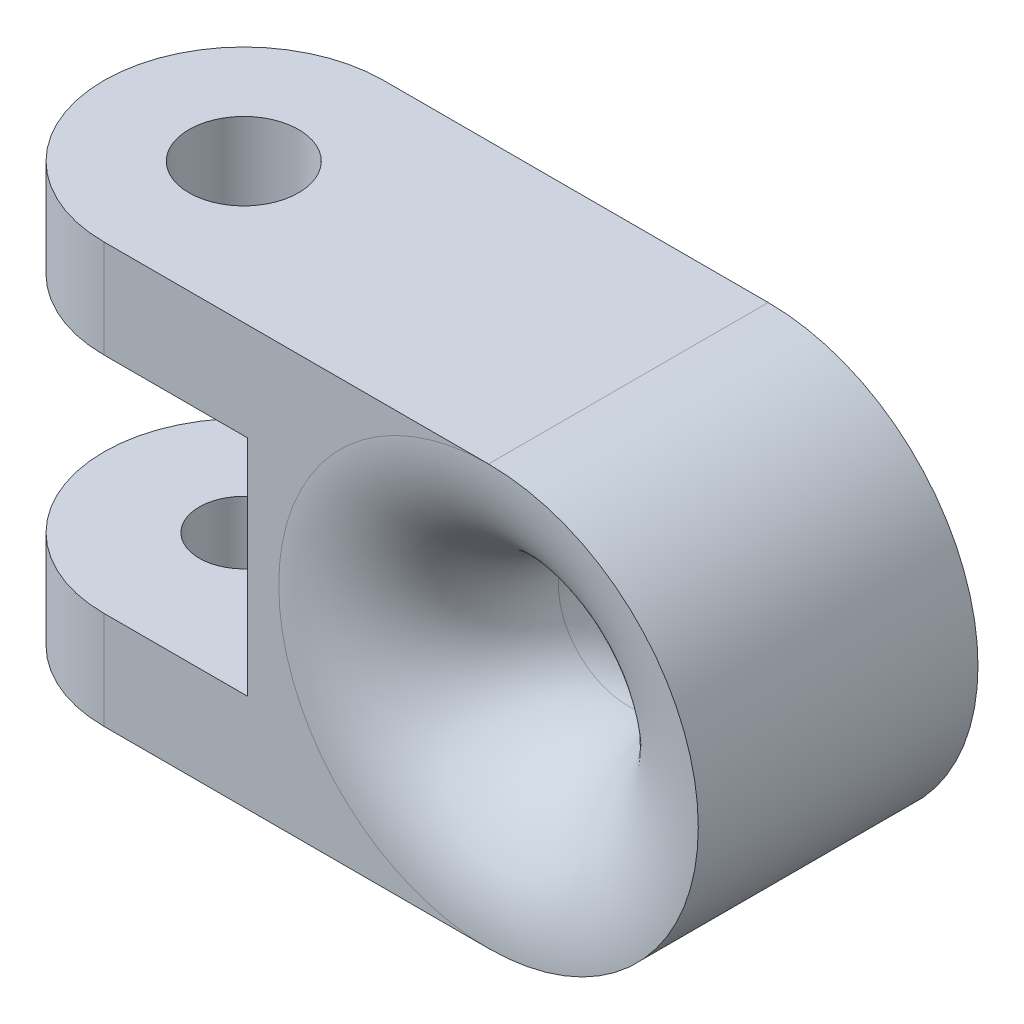
from build123d import *

# Parameters (mm, degrees)
BOSS_EXTRUDE1_DEPTH         = 9.525
BOSS_EXTRUDE2_DEPTH         = 12.7
CUT_EXTRUDE1_DEPTH          = 5.08
F_10_32_TAPPED_HOLE1_D      = 4.0386
F_10_32_TAPPED_HOLE1_DEPTH  = 4.445
F_10_CLEARANCE_HOLE1_D      = 4.9784
F_10_CLEARANCE_HOLE1_DEPTH  = 14.604
F_1_4_0_25_DIAMETER_HOLE1_D = 6.35
FILLET1_R                   = 6.35


with BuildPart() as part:
    # Sketch1 → Boss-Extrude1 (new, symmetric)
    with BuildSketch(Plane(origin=(0, 0, 0), x_dir=(1, 0, 0), z_dir=(0, 1, 0))):
        with BuildLine():
            Line((0, -6.35), (-11.1125, -6.35))
            ThreePointArc((-11.1125, -6.35), (-17.4625, 0), (-11.1125, 6.35))
            Line((-11.1125, 6.35), (0, 6.35))
            Line((0, 6.35), (0, -6.35))
        make_face()
    extrude(amount=BOSS_EXTRUDE1_DEPTH, both=True)

    # Sketch2 → Boss-Extrude2 (add)
    with BuildSketch(Plane.XY.offset(6.35)):
        with BuildLine():
            Line((0, 9.525), (6.35, 9.525))
            ThreePointArc((6.35, 9.525), (15.875, 0), (6.35, -9.525))
            Line((6.35, -9.525), (0, -9.525))
            ThreePointArc((0, -9.525), (-9.525, 0), (0, 9.525))
        make_face()
    extrude(amount=-BOSS_EXTRUDE2_DEPTH)

    # Sketch3 → Cut-Extrude1 (cut, symmetric)
    with BuildSketch(Plane(origin=(0, 0, 0), x_dir=(1, 0, 0), z_dir=(0, 1, 0))):
        with BuildLine():
            Line((-4.588999966, 6.35), (-11.1125, 6.35))
            ThreePointArc((-11.1125, 6.35), (-17.4625, 0), (-11.1125, -6.35))
            Line((-11.1125, -6.35), (-4.588999966, -6.35))
            Line((-4.588999966, -6.35), (-4.588999966, 6.35))
        make_face()
    extrude(amount=CUT_EXTRUDE1_DEPTH, both=True, mode=Mode.SUBTRACT)

    # #10-32 Tapped Hole1
    with Locations(Plane(origin=(0, -5.08, 0), x_dir=(1, 0, 0), z_dir=(0, 1, 0))):
        with Locations((-11.1125, 0)):
            Hole(F_10_32_TAPPED_HOLE1_D / 2, depth=F_10_32_TAPPED_HOLE1_DEPTH)

    # #10 Clearance Hole1
    with Locations(Plane(origin=(0, 9.525, 0), x_dir=(1, 0, 0), z_dir=(0, 1, 0))):
        with Locations((-11.1125, 0)):
            Hole(F_10_CLEARANCE_HOLE1_D / 2, depth=F_10_CLEARANCE_HOLE1_DEPTH)

    # 1/4 (0.25) Diameter Hole1 (through all)
    with Locations(Plane(origin=(0, 0, -6.35), x_dir=(-1, 0, 0), z_dir=(0, 0, -1))):
        with Locations((-6.35, 0)):
            Hole(F_1_4_0_25_DIAMETER_HOLE1_D / 2)

    # Fillet1
    fillet1_edges = [part.edges().sort_by_distance(p)[0] for p in [
        (3.175, 0, -6.35),
        (3.175, 0, 6.35),
    ]]
    fillet(fillet1_edges, radius=FILLET1_R - 0.0001)  # a hair under: the kernel refuses the full size


solid = part.part
